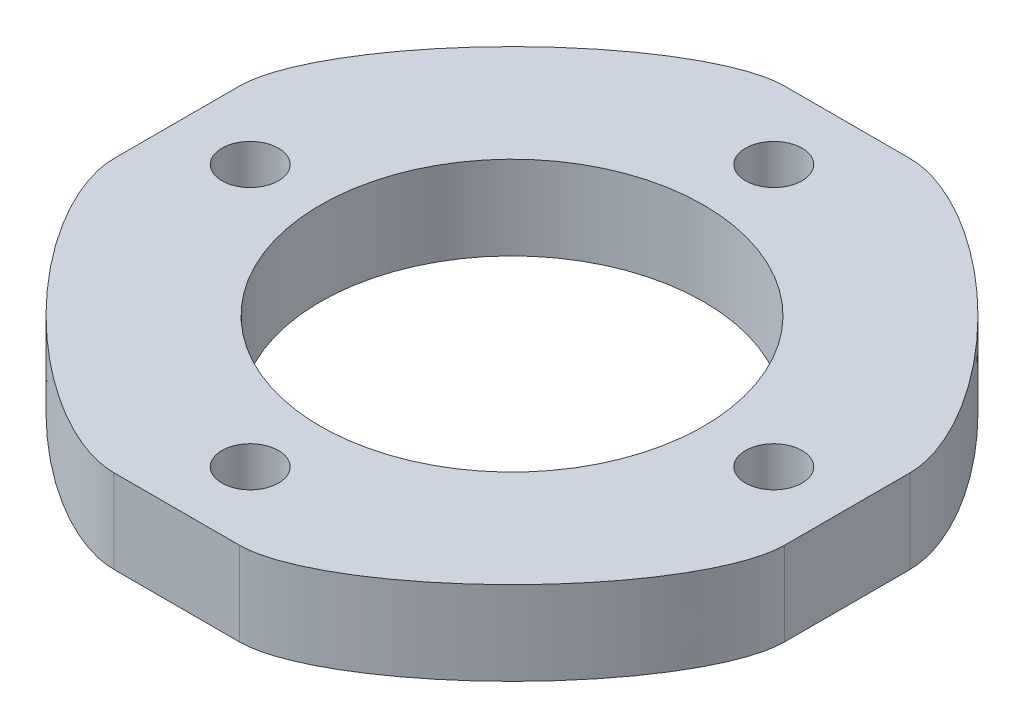
from build123d import *

# Parameters (mm, degrees)
SKETCH1_W           = 32
SKETCH1_H           = 32
BOSS_EXTRUDE1_DEPTH = 4
SKETCH2_R           = 9.15
SKETCH2_R_2         = 1.35
CUT_EXTRUDE1_DEPTH  = 4
FILLET1_SIZE        = 13


with BuildPart() as part:
    # Sketch1 → Boss-Extrude1 (new body)
    with BuildSketch(Plane(origin=(0, 0, 0), x_dir=(1, 0, 0), z_dir=(0, 1, 0))):
        with Locations((16, -16)):
            Rectangle(SKETCH1_W, SKETCH1_H)
    extrude(amount=BOSS_EXTRUDE1_DEPTH)

    # Sketch2 → Cut-Extrude1 (cut)
    with BuildSketch(Plane(origin=(0, 0, 0), x_dir=(-1, 0, 0), z_dir=(0, -1, 0))):
        with Locations(Location((-16, -16, 0), (0, 0, 90))):
            Circle(SKETCH2_R)
        with Locations(Location((-16, -28.5, 0), (0, 0, 90))):
            Circle(SKETCH2_R_2)
        with Locations(Location((-28.5, -16, 0), (0, 0, 90))):
            Circle(SKETCH2_R_2)
        with Locations(Location((-16, -3.5, 0), (0, 0, 90))):
            Circle(SKETCH2_R_2)
        with Locations(Location((-3.5, -16, 0), (0, 0, 90))):
            Circle(SKETCH2_R_2)
    extrude(amount=-CUT_EXTRUDE1_DEPTH, mode=Mode.SUBTRACT)

    # Fillet1
    # a fillet whose section is not a circle: 13 mm, written as the material it takes off along each edge
    with BuildSketch(Plane(origin=(0, -32.5, 0), x_dir=(1, 0, 0), z_dir=(0, 1, 0)), Plane(origin=(0, -32.5, 32), x_dir=(0, 0, -1), z_dir=(0, 1, 0))) as fillet1_piece_1:
        with BuildLine():
            Bezier((FILLET1_SIZE, 0), (0, 0), (0, -FILLET1_SIZE), weights=[1, 0.333333333, 1])
            Line((0, -FILLET1_SIZE), (0, 0))
            Line((0, 0), (FILLET1_SIZE, 0))
        make_face()
    extrude(amount=69, mode=Mode.SUBTRACT)
    with BuildSketch(Plane(origin=(32, -32.5, 0), x_dir=(-1, 0, 0), z_dir=(0, 1, 0)), Plane(origin=(32, -32.5, 32), x_dir=(0, 0, -1), z_dir=(0, 1, 0))) as fillet1_piece_2:
        with BuildLine():
            Bezier((FILLET1_SIZE, 0), (0, 0), (0, FILLET1_SIZE), weights=[1, 0.333333333, 1])
            Line((0, FILLET1_SIZE), (0, 0))
            Line((0, 0), (FILLET1_SIZE, 0))
        make_face()
    extrude(amount=69, mode=Mode.SUBTRACT)


solid = part.part
